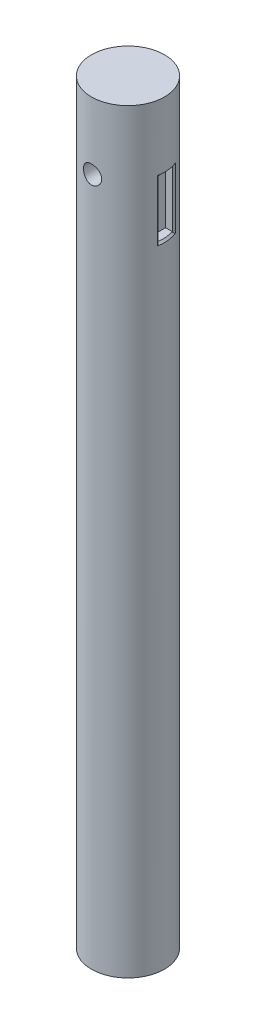
from build123d import *

# Parameters (mm, degrees)
CROQUIS1_R                 = 19.05
SALIENTE_EXTRUIR1_DEPTH    = 394
CORTAR_EXTRUIR1_DEPTH      = 395.919998227
CORTAR_EXTRUIR1_DEPTH_BACK = 395.919998227
CROQUIS2_R                 = 4.765
CORTAR_EXTRUIR2_DEPTH      = 397.295991136
CORTAR_EXTRUIR2_DEPTH_BACK = 5.45
CROQUIS4_W                 = 8.29
CROQUIS4_H                 = 29.8
CHAFL_N1_SIZE              = 1
CHAFL_N1_SIZE_2            = 0.898769363
CHAFL_N1_SIZE_3            = 0.790943361


with BuildPart() as part:
    # Croquis1 → Saliente-Extruir1 (new body)
    with BuildSketch(Plane(origin=(0, 0, 0), x_dir=(1, 0, 0), z_dir=(0, 1, 0))):
        with Locations(Location((0, 0, 0), (0, 0, 270))):
            Circle(CROQUIS1_R)
    extrude(amount=SALIENTE_EXTRUIR1_DEPTH)

    # Croquis2 → Cortar-Extruir1 (cut, two sides: drawn at the far end of the back side and taken through both)
    with BuildSketch(Plane.XY.offset(-CORTAR_EXTRUIR1_DEPTH_BACK)):
        with Locations(Location((0, 359, 0), (0, 0, 90.000000003))):
            Circle(CROQUIS2_R)
    extrude(amount=CORTAR_EXTRUIR1_DEPTH + CORTAR_EXTRUIR1_DEPTH_BACK, mode=Mode.SUBTRACT)

    # Croquis4 → Cortar-Extruir2 (cut, two sides: drawn at the far end of the back side and taken through both)
    with BuildSketch(Plane(origin=(19.05, 0, 0), x_dir=(0, 0, -1), z_dir=(1, 0, 0)).offset(-CORTAR_EXTRUIR2_DEPTH_BACK)):
        with Locations((1.862063648, 344.1)):
            Rectangle(CROQUIS4_W, CROQUIS4_H)
    extrude(amount=CORTAR_EXTRUIR2_DEPTH + CORTAR_EXTRUIR2_DEPTH_BACK, mode=Mode.SUBTRACT)

    # Chaflán1
    # the kernel refuses this chamfer: 1, 0.898769363, 0.790943361 mm, written as the material it takes off along each edge
    with BuildSketch(Plane(origin=(0, 329.2, 0), x_dir=(0.8979062520865971, 0, -0.4401867359017083), z_dir=(-0.4401867359017083, 0, -0.8979062520865971))) as chafl_n1_piece_1_section:
        Polygon((19.05, CHAFL_N1_SIZE), (19.05 - CHAFL_N1_SIZE, 0), (19.05, 0), align=None)
    chafl_n1_piece_1 = revolve(axis=Axis((0, 329.2, 0), (0, -1, 0)), revolution_arc=40.733590892, mode=Mode.PRIVATE)
    chafl_n1_piece_1 = split(chafl_n1_piece_1, bisect_by=Plane(origin=(0, 329.2, 2.282936352), z_dir=(0, 0, -1)), keep=Keep.TOP, mode=Mode.PRIVATE)
    chafl_n1_piece_1 = split(chafl_n1_piece_1, bisect_by=Plane(origin=(0, 329.2, -6.007063648), z_dir=(0, 0, 1)), keep=Keep.TOP, mode=Mode.PRIVATE)
    add(chafl_n1_piece_1, mode=Mode.SUBTRACT)
    with BuildSketch(Plane(origin=(0, 359, 0), x_dir=(0.8979062520865971, 0, -0.4401867359017083), z_dir=(-0.4401867359017083, 0, -0.8979062520865971))) as chafl_n1_piece_2_section:
        Polygon((19.05, -CHAFL_N1_SIZE), (19.05 - CHAFL_N1_SIZE, 0), (19.05, 0), align=None)
    chafl_n1_piece_2 = revolve(axis=Axis((0, 359, 0), (0, -1, 0)), revolution_arc=40.733590892, mode=Mode.PRIVATE)
    chafl_n1_piece_2 = split(chafl_n1_piece_2, bisect_by=Plane(origin=(0, 359, 2.282936352), z_dir=(0, 0, -1)), keep=Keep.TOP, mode=Mode.PRIVATE)
    chafl_n1_piece_2 = split(chafl_n1_piece_2, bisect_by=Plane(origin=(0, 359, -6.007063648), z_dir=(0, 0, 1)), keep=Keep.TOP, mode=Mode.PRIVATE)
    add(chafl_n1_piece_2, mode=Mode.SUBTRACT)
    with BuildSketch(Plane(origin=(18.912712698, 359, 2.282936352), x_dir=(-0.1452151757871569, 0, 0.9894000973929127), z_dir=(0, -1, 0))) as chafl_n1_piece_3:
        with BuildLine():
            Line((0.975350899, 0), (CHAFL_N1_SIZE_2 * 0.14521517582, CHAFL_N1_SIZE_2 * 0.989400097614))
            Line((CHAFL_N1_SIZE_2 * 0.14521517582, CHAFL_N1_SIZE_2 * 0.989400097614), (0, 0))
            ThreePointArc((0, 0), (0.501444944, -0.006238234), (0.975350899, 0))
        make_face()
    extrude(amount=29.8, mode=Mode.SUBTRACT)
    with BuildSketch(Plane(origin=(18.078099633, 359, -6.007063648), x_dir=(-0.33952178475198846, 0, -0.9405981914073748), z_dir=(0, -1, 0))) as chafl_n1_piece_4:
        with BuildLine():
            Line((0.975350899, 0), (CHAFL_N1_SIZE_3 * 0.339521784837, -CHAFL_N1_SIZE_3 * 0.940598191643))
            Line((CHAFL_N1_SIZE_3 * 0.339521784837, -CHAFL_N1_SIZE_3 * 0.940598191643), (0, 0))
            ThreePointArc((0, 0), (0.501444944, 0.006238234), (0.975350899, 0))
        make_face()
    extrude(amount=29.8, mode=Mode.SUBTRACT)
    with BuildSketch(Plane(origin=(0, 329.2, 0), x_dir=(0.8979062520865971, 0, -0.4401867359017083), z_dir=(-0.4401867359017083, 0, -0.8979062520865971))) as chafl_n1_piece_5a_section:
        Polygon((19.05, CHAFL_N1_SIZE), (19.05 - CHAFL_N1_SIZE, 0), (19.05, 0), align=None)
    chafl_n1_piece_5a = revolve(axis=Axis((0, 329.2, 0), (0, -1, 0)), revolution_arc=40.733590892, mode=Mode.PRIVATE)
    chafl_n1_piece_5a = split(chafl_n1_piece_5a, bisect_by=Plane(origin=(0, 329.2, -6.007063648), z_dir=(0, 0, -1)), keep=Keep.TOP, mode=Mode.PRIVATE)
    with BuildSketch(Plane(origin=(18.078099633, 359, -6.007063648), x_dir=(-0.33952178475198846, 0, -0.9405981914073748), z_dir=(0, -1, 0))) as chafl_n1_piece_5b_section:
        with BuildLine():
            Line((0.975350899, 0), (CHAFL_N1_SIZE_3 * 0.339521784837, -CHAFL_N1_SIZE_3 * 0.940598191643))
            Line((CHAFL_N1_SIZE_3 * 0.339521784837, -CHAFL_N1_SIZE_3 * 0.940598191643), (0, 0))
            ThreePointArc((0, 0), (0.501444944, 0.006238234), (0.975350899, 0))
        make_face()
    chafl_n1_piece_5b = extrude(amount=32.308302498, mode=Mode.PRIVATE)
    chafl_n1_piece_5b = split(chafl_n1_piece_5b, bisect_by=Plane(origin=(18.078099633, 329.2, -6.007063648), z_dir=(0, -1, 0)), keep=Keep.TOP, mode=Mode.PRIVATE)
    chafl_n1_piece_5 = chafl_n1_piece_5a & chafl_n1_piece_5b
    add(chafl_n1_piece_5, mode=Mode.SUBTRACT)
    with BuildSketch(Plane(origin=(0, 329.2, 0), x_dir=(0.8979062520865971, 0, -0.4401867359017083), z_dir=(-0.4401867359017083, 0, -0.8979062520865971))) as chafl_n1_piece_6a_section:
        Polygon((19.05, CHAFL_N1_SIZE), (19.05 - CHAFL_N1_SIZE, 0), (19.05, 0), align=None)
    chafl_n1_piece_6a = revolve(axis=Axis((0, 329.2, 0), (0, -1, 0)), revolution_arc=40.733590892, mode=Mode.PRIVATE)
    chafl_n1_piece_6a = split(chafl_n1_piece_6a, bisect_by=Plane(origin=(0, 329.2, 2.282936352), z_dir=(0, 0, 1)), keep=Keep.TOP, mode=Mode.PRIVATE)
    with BuildSketch(Plane(origin=(18.912712698, 359, 2.282936352), x_dir=(-0.1452151757871569, 0, 0.9894000973929127), z_dir=(0, -1, 0))) as chafl_n1_piece_6b_section:
        with BuildLine():
            Line((0.975350899, 0), (CHAFL_N1_SIZE_2 * 0.14521517582, CHAFL_N1_SIZE_2 * 0.989400097614))
            Line((CHAFL_N1_SIZE_2 * 0.14521517582, CHAFL_N1_SIZE_2 * 0.989400097614), (0, 0))
            ThreePointArc((0, 0), (0.501444944, -0.006238234), (0.975350899, 0))
        make_face()
    chafl_n1_piece_6b = extrude(amount=32.308302498, mode=Mode.PRIVATE)
    chafl_n1_piece_6b = split(chafl_n1_piece_6b, bisect_by=Plane(origin=(18.912712698, 329.2, 2.282936352), z_dir=(0, -1, 0)), keep=Keep.TOP, mode=Mode.PRIVATE)
    chafl_n1_piece_6 = chafl_n1_piece_6a & chafl_n1_piece_6b
    add(chafl_n1_piece_6, mode=Mode.SUBTRACT)
    with BuildSketch(Plane(origin=(0, 359, 0), x_dir=(0.8979062520865971, 0, -0.4401867359017083), z_dir=(-0.4401867359017083, 0, -0.8979062520865971))) as chafl_n1_piece_7a_section:
        Polygon((19.05, -CHAFL_N1_SIZE), (19.05 - CHAFL_N1_SIZE, 0), (19.05, 0), align=None)
    chafl_n1_piece_7a = revolve(axis=Axis((0, 359, 0), (0, -1, 0)), revolution_arc=40.733590892, mode=Mode.PRIVATE)
    chafl_n1_piece_7a = split(chafl_n1_piece_7a, bisect_by=Plane(origin=(0, 359, -6.007063648), z_dir=(0, 0, -1)), keep=Keep.TOP, mode=Mode.PRIVATE)
    with BuildSketch(Plane(origin=(18.078099633, 361.508302498, -6.007063648), x_dir=(-0.33952178475198846, 0, -0.9405981914073748), z_dir=(0, -1, 0))) as chafl_n1_piece_7b_section:
        with BuildLine():
            Line((0.975350899, 0), (CHAFL_N1_SIZE_3 * 0.339521784837, -CHAFL_N1_SIZE_3 * 0.940598191643))
            Line((CHAFL_N1_SIZE_3 * 0.339521784837, -CHAFL_N1_SIZE_3 * 0.940598191643), (0, 0))
            ThreePointArc((0, 0), (0.501444944, 0.006238234), (0.975350899, 0))
        make_face()
    chafl_n1_piece_7b = extrude(amount=32.308302498, mode=Mode.PRIVATE)
    chafl_n1_piece_7b = split(chafl_n1_piece_7b, bisect_by=Plane(origin=(18.078099633, 359, -6.007063648), z_dir=(0, 1, 0)), keep=Keep.TOP, mode=Mode.PRIVATE)
    chafl_n1_piece_7 = chafl_n1_piece_7a & chafl_n1_piece_7b
    add(chafl_n1_piece_7, mode=Mode.SUBTRACT)
    with BuildSketch(Plane(origin=(18.912712698, 361.508302498, 2.282936352), x_dir=(-0.1452151757871569, 0, 0.9894000973929127), z_dir=(0, -1, 0))) as chafl_n1_piece_8a_section:
        with BuildLine():
            Line((0.975350899, 0), (CHAFL_N1_SIZE_2 * 0.14521517582, CHAFL_N1_SIZE_2 * 0.989400097614))
            Line((CHAFL_N1_SIZE_2 * 0.14521517582, CHAFL_N1_SIZE_2 * 0.989400097614), (0, 0))
            ThreePointArc((0, 0), (0.501444944, -0.006238234), (0.975350899, 0))
        make_face()
    chafl_n1_piece_8a = extrude(amount=32.308302498, mode=Mode.PRIVATE)
    chafl_n1_piece_8a = split(chafl_n1_piece_8a, bisect_by=Plane(origin=(18.912712698, 359, 2.282936352), z_dir=(0, 1, 0)), keep=Keep.TOP, mode=Mode.PRIVATE)
    with BuildSketch(Plane(origin=(0, 359, 0), x_dir=(0.8979062520865971, 0, -0.4401867359017083), z_dir=(-0.4401867359017083, 0, -0.8979062520865971))) as chafl_n1_piece_8b_section:
        Polygon((19.05, -CHAFL_N1_SIZE), (19.05 - CHAFL_N1_SIZE, 0), (19.05, 0), align=None)
    chafl_n1_piece_8b = revolve(axis=Axis((0, 359, 0), (0, -1, 0)), revolution_arc=40.733590892, mode=Mode.PRIVATE)
    chafl_n1_piece_8b = split(chafl_n1_piece_8b, bisect_by=Plane(origin=(0, 359, 2.282936352), z_dir=(0, 0, 1)), keep=Keep.TOP, mode=Mode.PRIVATE)
    chafl_n1_piece_8 = chafl_n1_piece_8a & chafl_n1_piece_8b
    add(chafl_n1_piece_8, mode=Mode.SUBTRACT)


solid = part.part
